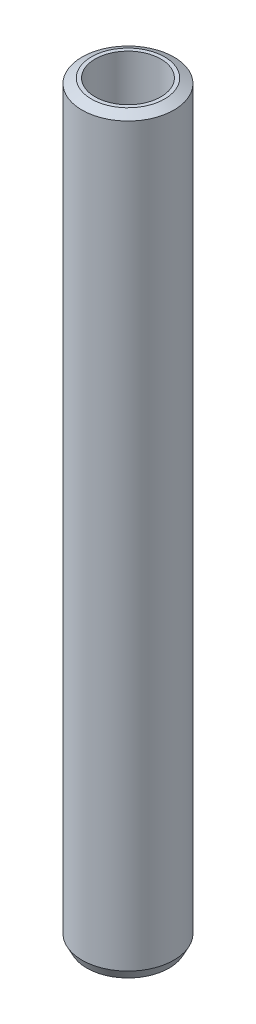
from build123d import *
from OCP.BRepFilletAPI import BRepFilletAPI_MakeChamfer

# Parameters (mm, degrees)
SKETCH1_R           = 32.5
BOSS_EXTRUDE1_DEPTH = 530.44934434
SKETCH2_R           = 23.229542398
CUT_EXTRUDE1_DEPTH  = 533.436857205
CHAMFER1_SIZE       = 3.43072963
CHAMFER1_SIZE2      = 6.638501957


with BuildPart() as part:
    # Sketch1 → Boss-Extrude1 (new body)
    with BuildSketch(Plane(origin=(0, 0, 0), x_dir=(1, 0, 0), z_dir=(0, 1, 0))):
        Circle(SKETCH1_R)
    extrude(amount=BOSS_EXTRUDE1_DEPTH)

    # Sketch2 → Cut-Extrude1 (cut, through all)
    with BuildSketch(Plane(origin=(0, 0, 0), x_dir=(1, 0, 0), z_dir=(0, 1, 0))):
        Circle(SKETCH2_R)
    extrude(amount=CUT_EXTRUDE1_DEPTH, mode=Mode.SUBTRACT)

    # Chamfer1: one chamfer whose edges measure the first distance from different faces: ONE call of the kernel's chamfer builder (chamfer() names one face for all edges)
    chamfer1_edges_1 = [part.edges().sort_by_distance(p)[0] for p in [
        (-32.5, 530.44934434, 0),
    ]]
    chamfer1_side_1 = [part.faces().sort_by_distance(p)[0] for p in [
        (-32.5, 265.22467217, 0),
    ]]
    chamfer1_edges_2 = [part.edges().sort_by_distance(p)[0] for p in [
        (-32.5, 0, 0),
    ]]
    chamfer1_side_2 = [part.faces().sort_by_distance(p)[0] for p in [
        (-31.580761184, 0, 0),
    ]]
    chamfer1 = BRepFilletAPI_MakeChamfer(part.part.solid().wrapped)
    for e in chamfer1_edges_1:
        chamfer1.Add(CHAMFER1_SIZE, CHAMFER1_SIZE2, e.wrapped, chamfer1_side_1[0].wrapped)  # the first distance lies on this face
    for e in chamfer1_edges_2:
        chamfer1.Add(CHAMFER1_SIZE, CHAMFER1_SIZE2, e.wrapped, chamfer1_side_2[0].wrapped)  # the first distance lies on this face
    add(Compound.cast(chamfer1.Shape()), mode=Mode.REPLACE)


solid = part.part
